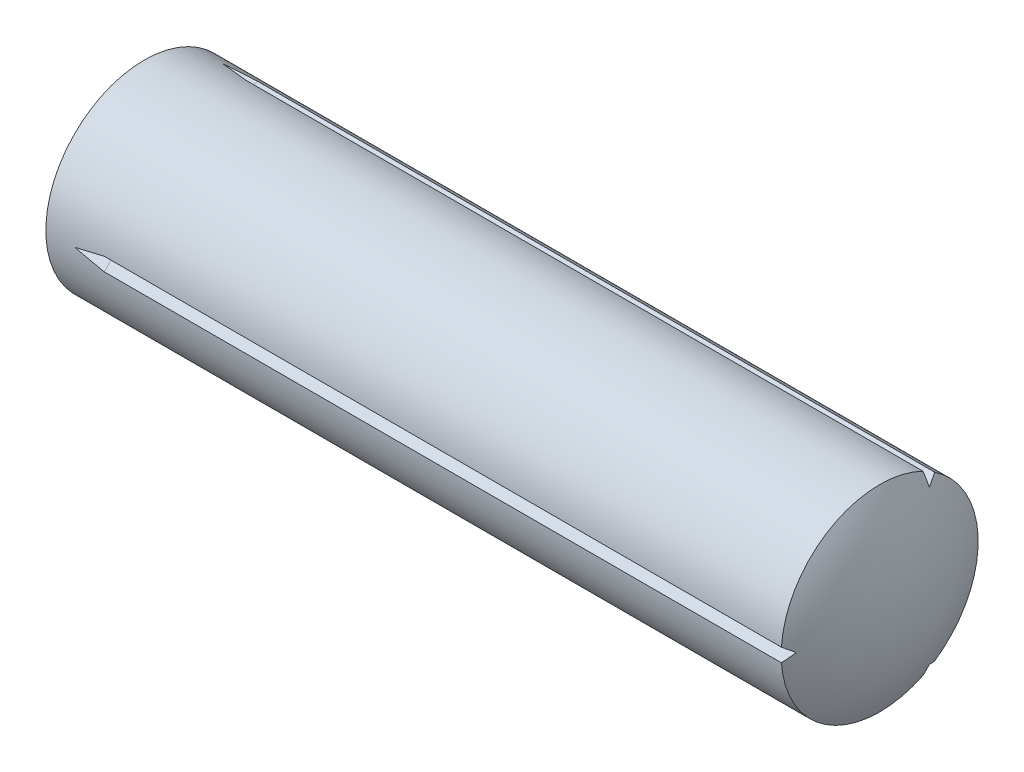
from build123d import *

# Parameters (mm, degrees)
CIRPATTERN1_COUNT = 3


with BuildPart() as part:
    # Sketch1 → Base-Revolve (revolve)
    with BuildSketch(Plane.XY):
        with BuildLine():
            Line((-100, 0), (-100, 1.25))
            ThreePointArc((-100, 1.25), (-99.010050505, 7.072345027), (-96.68190465, 12.5))
            Line((-96.68190465, 12.5), (-3.349364905, 12.5))
            ThreePointArc((-3.349364905, 12.5), (-0.851854343, 6.470476128), (0, 0))
            Line((0, 0), (-100, 0))
        make_face()
    revolve(axis=Axis((-117, 0, 0), (1, 0, 0)))

    # Cut-Sweep1: sweep along a path in Sketch4
    with BuildLine(Plane(origin=(0, 0, 0), x_dir=(1, 0, 0), z_dir=(0, 1, 0))) as cut_sweep1_path:
        Line((0, -11.25), (-89.5, -11.25))
        Line((-89.5, -11.25), (-93, -12.5))
    # Sketch2 → Cut-Sweep1 (sweep, cut)
    with BuildSketch(Plane(origin=(0, 0, 0), x_dir=(0, 0, -1), z_dir=(1, 0, 0))):
        Polygon((-11.25, 0), (-12.5, 0.875259423), (-12.5, -0.875259423), align=None)
    cut_sweep1 = sweep(path=cut_sweep1_path.line, transition=Transition.RIGHT, mode=Mode.SUBTRACT)

    # CirPattern1: Cut-Sweep1 ×3 about axis
    cirpattern1_axis = Axis((-117, 0, 0), (1, 0, 0))
    for i in range(1, CIRPATTERN1_COUNT):
        add(cut_sweep1.rotate(cirpattern1_axis, i * 360 / CIRPATTERN1_COUNT), mode=Mode.SUBTRACT)


solid = part.part
